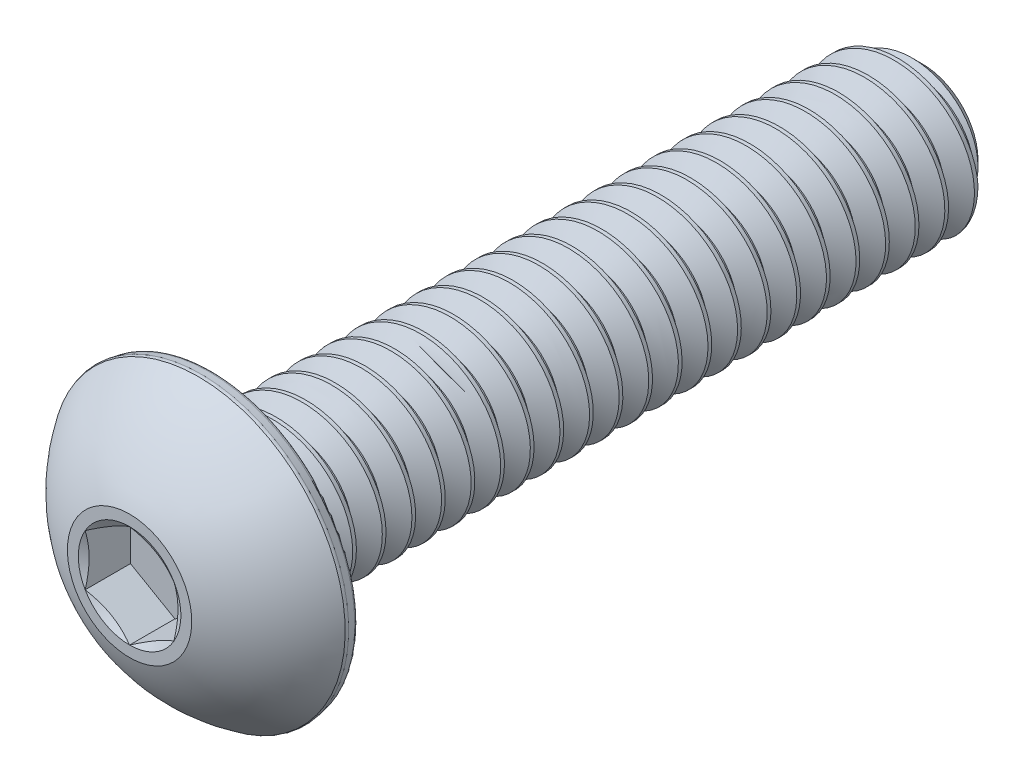
from build123d import *

# Parameters (mm, degrees)
CUT_EXTRUDE1_DEPTH = 1.21539
FILLET1_R          = 0.11049
CUT_SWEEP1_PITCH   = 0.79375
CUT_SWEEP1_TO      = 19.05


with BuildPart() as part:
    # Sketch3 → Revolve1 (revolve)
    with BuildSketch(Plane(origin=(0, 0, 0), x_dir=(0, 0, -1), z_dir=(1, 0, 0)), mode=Mode.PRIVATE) as revolve1_sk:
        with BuildLine():
            Line((-10.6299, 0), (-10.6299, 1.666875))
            ThreePointArc((-10.6299, 1.666875), (-9.877170588, 2.967189774), (-8.75157, 3.9624))
            Line((-8.75157, 3.9624), (-8.4201, 3.903952896))
            Line((-8.4201, 3.903952896), (-8.4201, 2.0828))
            Line((-8.4201, 2.0828), (10.0345875, 2.0828))
            Line((10.0345875, 2.0828), (10.6299, 1.4874875))
            Line((10.6299, 1.4874875), (10.6299, 0))
            Line((10.6299, 0), (-10.6299, 0))
        make_face()
    revolve(revolve1_sk.sketch.rotate(Axis((0, 0, 10.6299), (0, 0, -1)), 90), axis=Axis((0, 0, 10.6299), (0, 0, -1)))

    # Sketch4 → Cut-Extrude1 (cut)
    with BuildSketch(Plane.XY.offset(10.6299)):
        Polygon((-1.190625, -0.687407664), (0, -1.374815329), (1.190625, -0.687407664), (1.190625, 0.687407664), (0, 1.374815329), (-1.190625, 0.687407664), align=None)
    extrude(amount=-CUT_EXTRUDE1_DEPTH, mode=Mode.SUBTRACT)

    # Cut-Extrude2 cone 1 section (through the dimple's axis) → Cut-Extrude2 (revolve, cut)
    with BuildSketch(Plane(origin=(0, 0, 10.6299), x_dir=(0, -1, 0), z_dir=(1, 0, 0))):
        Polygon((0, 0), (1.374815329, 0), (0, 0.79375), align=None)
    revolve(axis=Axis((0, 0, 10.6299), (0, 0, -1)), mode=Mode.SUBTRACT)

    # Fillet1
    fillet1_edges = [part.edges().sort_by_distance(p)[0] for p in [
        (-3.903952896, 0, 8.4201),
        (-3.9624, 0, 8.75157),
    ]]
    fillet(fillet1_edges, radius=FILLET1_R)


with BuildPart() as body_2:
    # Split1: read off the stored shape, not the designer's step
    # Split1: the piece on the far side of the plane
    add(part.part)
    split(bisect_by=Plane.XY.offset(8.4201), keep=Keep.BOTTOM)

    # Cut-Sweep1: arcs per turn and ends read off the stored shape
    # Cut-Sweep1: the profile of Sketch7 screwed along a right-hand helix through 25 turns, 8 arcs to a turn; built about Z, then put on its axis
    cut_sweep1_z = Axis((0, 0, 0), (0, 0, 1))
    cut_sweep1_corners = [(2.125762979, 0, 0.024804688), (2.125762979, 0, -0.719335937), (1.567244252, 0, -0.396875), (1.567244252, 0, -0.29765625)]
    with BuildLine(mode=Mode.PRIVATE) as cut_sweep1_profile:
        Line(cut_sweep1_corners[0], cut_sweep1_corners[1])
        Line(cut_sweep1_corners[1], cut_sweep1_corners[2])
        Line(cut_sweep1_corners[2], cut_sweep1_corners[3])
        Line(cut_sweep1_corners[3], cut_sweep1_corners[0])
    cut_sweep1_cap = Face(cut_sweep1_profile.wire())
    cut_sweep1_turn_angles = [0, 22.5, 45, 67.5, 90, 112.5, 135, 157.5, 180, 202.5, 225, 247.5, 270, 292.5, 315, 337.5, 360]
    cut_sweep1_turn_weights = [1, 0.9238795325112867, 1, 0.9238795325112867, 1, 0.9238795325112867, 1, 0.9238795325112867, 1, 0.9238795325112867, 1, 0.9238795325112867, 1, 0.9238795325112867, 1, 0.9238795325112867, 1]
    cut_sweep1_turn_rails = [Edge.make_bspline([Vector(p[0], p[1], 0).rotate(cut_sweep1_z, cut_sweep1_turn_angles[k]) / cut_sweep1_turn_weights[k] + Vector(0, 0, p[2] + CUT_SWEEP1_PITCH * cut_sweep1_turn_angles[k] / 360) for k in range(17)], [0, 0, 0, 1, 1, 2, 2, 3, 3, 4, 4, 5, 5, 6, 6, 7, 7, 8, 8, 8], 2, cut_sweep1_turn_weights) for p in cut_sweep1_corners]
    cut_sweep1_turn_sides = [Face.make_surface_from_curves(cut_sweep1_turn_rails[p[0]], cut_sweep1_turn_rails[p[1]]) for p in [(0, 1), (1, 2), (2, 3), (3, 0)]]
    cut_sweep1 = Plane(origin=(0, 0, -10.6299), x_dir=(0, 1, 0), z_dir=(0, 0, 1)) * split(Solid(Shell([*[p.moved(Location((0, 0, CUT_SWEEP1_PITCH * i))) for i in range(25) for p in cut_sweep1_turn_sides], cut_sweep1_cap, cut_sweep1_cap.rotate(cut_sweep1_z, 9000).moved(Location((0, 0, CUT_SWEEP1_PITCH * 9000 / 360)))])), bisect_by=Plane.XY.offset(CUT_SWEEP1_TO), keep=Keep.BOTTOM, mode=Mode.PRIVATE)
    add(cut_sweep1, mode=Mode.SUBTRACT)


with BuildPart() as part_1:
    add(part.part)

    # Split1
    split(bisect_by=Plane.XY.offset(8.4201), keep=Keep.TOP)

    add(body_2.part)  # Boss-Extrude1 merges body 2
    # Boss-Extrude1: read off the stored shape, not the designer's step
    # Boss-Extrude1 outline → Boss-Extrude1 (revolve)
    with BuildSketch(Plane.XZ):
        Polygon((1.567239911, 8.4201), (1.567239911, 7.818613953), (2.168725958, 8.4201), align=None)
    revolve(axis=Axis((0, 0, 0), (0, 0, 1)))


solid = part_1.part
